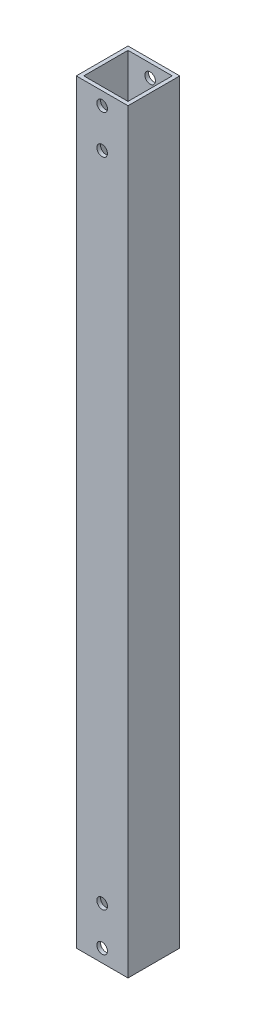
from build123d import *

# Parameters (mm, degrees)
SKETCH1_W           = 20
SKETCH1_H           = 20
SKETCH1_W_2         = 17.1
SKETCH1_H_2         = 17.1
BOSS_EXTRUDE1_DEPTH = 292
SKETCH2_R           = 2.05
CUT_EXTRUDE1_DEPTH  = 294.366664773


with BuildPart() as part:
    # Sketch1 → Boss-Extrude1 (new body)
    with BuildSketch(Plane(origin=(0, 0, 0), x_dir=(1, 0, 0), z_dir=(0, 1, 0))):
        with Locations((10, 10)):
            Rectangle(SKETCH1_W, SKETCH1_H)
        with Locations((10, 10)):
            Rectangle(SKETCH1_W_2, SKETCH1_H_2, mode=Mode.SUBTRACT)
    extrude(amount=BOSS_EXTRUDE1_DEPTH)

    # Sketch2 → Cut-Extrude1 (cut, through all)
    with BuildSketch(Plane(origin=(0, 0, -20), x_dir=(-1, 0, 0), z_dir=(0, 0, -1))):
        with Locations((-10, 287)):
            Circle(SKETCH2_R)
        with Locations((-10, 272)):
            Circle(SKETCH2_R)
        with Locations((-10, 20)):
            Circle(SKETCH2_R)
        with Locations((-10, 5)):
            Circle(SKETCH2_R)
    extrude(amount=-CUT_EXTRUDE1_DEPTH, mode=Mode.SUBTRACT)


solid = part.part
